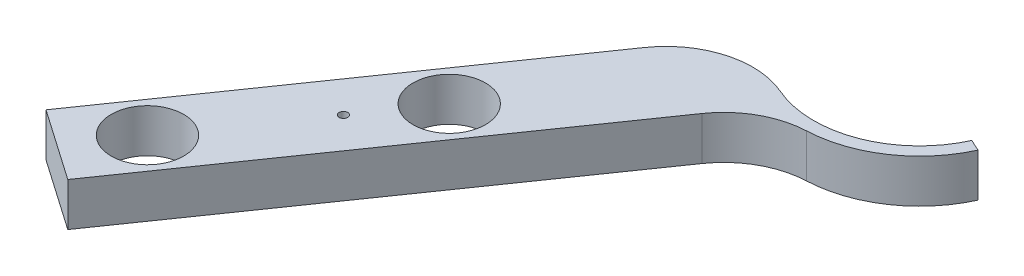
from build123d import *

# Parameters (mm, degrees)
SKETCH_2_R          = 4.175
EXTRUDE_1_DEPTH     = 5
FILLET_1_R          = 20
SKETCH_6_R          = 0.5000000000000009
CUT_EXTRUDE_3_DEPTH = 47.17452492507412
FILLET_2_R          = 10
CUT_EXTRUDE_4_DEPTH = 57.542041070345505
FILLET_3_R          = 10


with BuildPart() as part:
    # ｽｹｯﾁ2 → ﾎﾞｽ - 押し出し1 (new body)
    with BuildSketch(Plane(origin=(0, 0, 0), x_dir=(1, 0, 0), z_dir=(0, 1, 0))):
        with BuildLine():
            Line((8.269872578160966, 20.67530348178248), (-25.039362549658698, -27.29226699202151))
            Line((-25.039362549658694, -27.292266992021514), (-16.82553632293364, -32.996042821869985))
            Line((-16.82553632293364, -32.996042821869985), (16.77540554807104, 15.391605258271007))
            ThreePointArc((16.775405548070047, 15.39160525826554), (17.036467269075846, 15.346625845237856), (17.298352710232226, 15.306721140237647))
            Line((17.29835271023301, 15.306721140243175), (12.453720459223167, 18.670889747549086))
            ThreePointArc((12.453720459220065, 18.67088974754445), (7.082723548852389, 27.619577165201054), (10.596791286456618, 37.44698487250789))
            Line((10.596791286456803, 37.44698487250808), (9.571486453740173, 38.47228970522472))
            ThreePointArc((9.571486453736274, 38.47228970522862), (5.609855036074267, 29.81593956245965), (8.269872578156503, 20.675303481779164))
        make_face()
        with Locations(Location((-2.3951779892886145, -3.4492196700893225, 0), (0, 0, 270))):
            Circle(SKETCH_2_R, mode=Mode.SUBTRACT)
        with Locations(Location((-16.654617563909806, -23.98378523690196, 0), (0, 0, 270))):
            Circle(SKETCH_2_R, mode=Mode.SUBTRACT)
    extrude_1 = extrude(amount=EXTRUDE_1_DEPTH)

    # ﾌｨﾚｯﾄ1
    # the kernel refuses this fillet: 20 mm, written as the material it adds along each edge
    with BuildSketch(Plane(origin=(16.775405548070545, 0, -15.391605258268275), x_dir=(-0.5703775829850781, 0, 0.8213826226723454), z_dir=(0, 1, 0))) as fillet_1_piece_1_section:
        with BuildLine():
            CenterArc((4.1176832280817175, 20.000000000000004), FILLET_1_R, 257.44880249712094, 12.55119750289515)
            Line((-0.22855499889395509, 0.4779557096502993), (-0.31547976343346945, 0.08751482384330647))
            ThreePointArc((-0.31547976343346945, 0.08751482384330647), (-0.47282168846060246, 0.06752459028858156), (-0.36414407682378114, -0.16552670876373804))
            Line((-0.36414407682378114, -0.16552670876373804), (1.117e-13, -0.3999999999999987))
            Line((1.117e-13, -0.3999999999999987), (4.117683228087442, -0.39999999999999974))
            Line((4.117683228087442, -0.39999999999999974), (4.117683228087329, 1.7e-16))
        make_face()
    fillet_1_piece_1 = extrude(amount=5, mode=Mode.PRIVATE)
    fillet_1_piece_1 = split(fillet_1_piece_1, bisect_by=Plane(origin=(16.82290798810791, 2.5, -15.63687544831251), z_dir=(-0.570377582984848, 0, 0.8213826226725052)), keep=Keep.TOP, mode=Mode.PRIVATE)
    add(fillet_1_piece_1)
    with BuildSketch(Plane(origin=(8.269872578158733, 0, -20.675303481780823), x_dir=(-0.5703775829847766, 0, 0.8213826226725548), z_dir=(0, 1, 0))) as fillet_1_piece_2:
        with BuildLine():
            CenterArc((10.285673470537454, -20.000000000000007), FILLET_1_R, 89.99999999999505, 43.641913313262535)
            Line((-3.5173087138816013, -5.526656128709918), (-3.7933683575699813, -5.237189251284115))
            ThreePointArc((-3.7933683575699813, -5.237189251284115), (-1.7596460761489088, -2.7626969082759216), (-0.3791309613113661, 0.1275135842768152))
            Line((-0.3791309613113661, 0.1275135842768152), (3.413e-14, 0.40000000000000013))
            Line((3.413e-14, 0.40000000000000013), (10.285673470539217, 0.4000000000000006))
            Line((10.285673470539217, 0.4000000000000006), (10.285673470539184, -6e-17))
        make_face()
    extrude(amount=5)

    # ｽｹｯﾁ6 → ｶｯﾄ - 押し出し3 (cut, through all)
    with BuildSketch(Plane(origin=(0, 5, 0), x_dir=(1, 0, 0), z_dir=(0, 1, 0))):
        with Locations(Location((-7.408738509451215, -10.639307664730705, 0), (0, 0, 270))):
            Circle(SKETCH_6_R)
    cut_extrude_3 = extrude(amount=-CUT_EXTRUDE_3_DEPTH, mode=Mode.SUBTRACT)

    # ﾌｨﾚｯﾄ2
    fillet_2_edges = [part.edges().sort_by_distance(p)[0] for p in [
        (17.29835271023262, 2.5, -15.30672114024041),
    ]]
    fillet(fillet_2_edges, radius=FILLET_2_R)

    # ﾐﾗｰ1: ﾎﾞｽ - 押し出し1, ｶｯﾄ - 押し出し3 across plane
    add(extrude_1.mirror(Plane(origin=(4.106913113362459, 5, 2.8518879149242107), x_dir=(-0.5703775829848504, 0, 0.8213826226725034), z_dir=(-0.8213826226725035, 0, -0.5703775829848503))))
    add(cut_extrude_3.mirror(Plane(origin=(4.106913113362459, 5, 2.8518879149242107), x_dir=(-0.5703775829848504, 0, 0.8213826226725034), z_dir=(-0.8213826226725035, 0, -0.5703775829848503))), mode=Mode.SUBTRACT)

    # ｽｹｯﾁ7 → ｶｯﾄ - 押し出し4 (cut, through all)
    with BuildSketch(Plane(origin=(0, 5, 0), x_dir=(1, 0, 0), z_dir=(0, 1, 0))):
        Polygon((-16.825536322933814, -32.99604282186991), (31.619002207822653, 36.767396870690376), (6.63537695599359, 54.116314892564866), (-41.809161574762875, -15.647124799995419), align=None)
    extrude(amount=-CUT_EXTRUDE_4_DEPTH, mode=Mode.SUBTRACT)

    # ﾌｨﾚｯﾄ3
    fillet_3_edges = [part.edges().sort_by_distance(p)[0] for p in [
        (24.69752503161028, 2.5, -9.267751822082793),
        (16.905768195919187, 2.5, -15.579336362687311),
        (21.357815932613555, 2.5, -12.487782977823219),
    ]]
    fillet(fillet_3_edges, radius=FILLET_3_R)


solid = part.part
